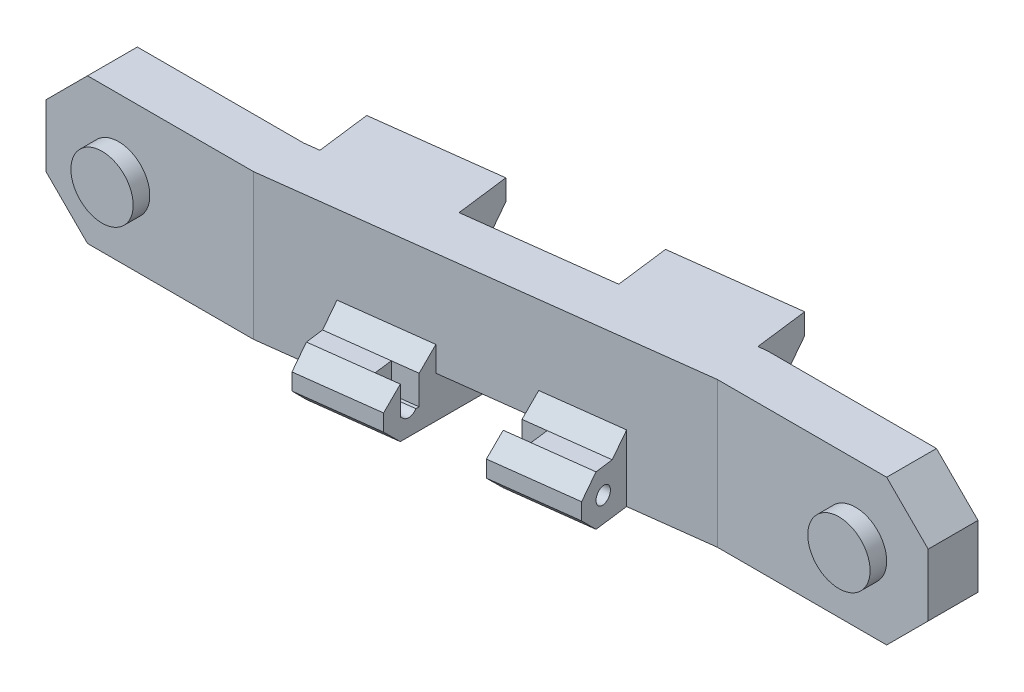
from build123d import *

# Parameters (mm, degrees)
BOSS_EXTRUDE4_DEPTH      = 2.4
BOSS_EXTRUDE4_2_DEPTH    = 2.4
BOSS_EXTRUDE4_3_DEPTH    = 2.4
BOSS_EXTRUDE4_4_DEPTH    = 2.4
BOSS_EXTRUDE5_DEPTH      = 7
SKETCH2_R                = 1.499999999999997
BOSS_EXTRUDE8_DEPTH      = 0.8
SKETCH3_R                = 1.5000000000000007
BOSS_EXTRUDE9_DEPTH      = 0.8
SKETCH4_R                = 1.6999999999999995
CUT_EXTRUDE3_DEPTH       = 1.2
SKETCH5_R                = 1.6999999999999995
CUT_EXTRUDE4_DEPTH       = 1.2
CHAMFER4_SIZE            = 2
CUT_EXTRUDE7_REACH       = 33.329
SKETCH8_R                = 0.3999999999999905
SKETCH8_R_2              = 0.4000000000000032
CUT_EXTRUDE10_DEPTH      = 2
CHAMFER6_SIZE            = 0.8
CUT_EXTRUDE11_DEPTH      = 10
CUT_EXTRUDE11_DEPTH_BACK = 1.4
BOSS_EXTRUDE10_DEPTH     = 3.6
CHAMFER8_SIZE            = 2.6


with BuildPart() as part:
    # Sketch1 → Boss-Extrude4 (new body)
    with BuildSketch(Plane(origin=(0, 0, 0), x_dir=(1, 0, 0), z_dir=(0, 1, 0))):
        Polygon((-6.430686748297487, -2.000308799271804), (-6.118186748297487, -4.480700653394857), (-2.1999999999999993, -3.9870555235708633), (-2.1999999999999997, -1.4672923701760037), align=None)
    extrude(amount=BOSS_EXTRUDE4_DEPTH)



with BuildPart() as body_2:
    # Sketch1 → Boss-Extrude4 2 (new body)
    with BuildSketch(Plane(origin=(0, 0, 0), x_dir=(1, 0, 0), z_dir=(0, 1, 0))):
        Polygon((-10.000000000000064, 2.4499999999999993), (-9.689951018234682, -0.01093750000000027), (-6.316618096627332, 0.41406249999999967), (-6.626667078392713, 2.8750000000000004), align=None)
    extrude(amount=BOSS_EXTRUDE4_2_DEPTH)


with BuildPart() as body_3:
    # Sketch1 → Boss-Extrude4 3 (new body)
    with BuildSketch(Plane(origin=(0, 0, 0), x_dir=(1, 0, 0), z_dir=(0, 1, 0))):
        Polygon((5.961321581281771, -0.4390625000000079), (2.200000000000001, -0.9129444764291388), (2.200000000000001, -3.432707629823996), (6.273821581281774, -2.919454354123064), align=None)
    extrude(amount=BOSS_EXTRUDE4_3_DEPTH)


with BuildPart() as body_4:
    # Sketch1 → Boss-Extrude4 4 (new body)
    with BuildSketch(Plane(origin=(0, 0, 0), x_dir=(1, 0, 0), z_dir=(0, 1, 0))):
        Polygon((6.159752929611616, 4.485937500000006), (6.469801911377001, 2.025000000000001), (9.843134832984354, 2.4499999999999993), (9.533085851218969, 4.910937500000012), align=None)
    extrude(amount=BOSS_EXTRUDE4_4_DEPTH)


with BuildPart() as part_1:
    add(part.part)

    add(body_2.part)  # Boss-Extrude5 merges body 2

    add(body_3.part)  # Boss-Extrude5 merges body 3

    add(body_4.part)  # Boss-Extrude5 merges body 4
    # Sketch1<8> → Boss-Extrude5 (add)
    with BuildSketch(Plane(origin=(0, 0, 0), x_dir=(1, 0, 0), z_dir=(0, 1, 0))):
        Polygon((-20, -0.05000000000000027), (-20, -2.45), (-12, -2.4499999999999997), (-10.000000000000064, -2.4499999999999997), (-6.430686748297488, -2.000308799271796), (-2.5125, -1.5066636694477982), (-2.1999999999999993, -1.467292370176004), (-2.1999999999999997, 0.9327076298239989), (-6.316618096627332, 0.41406249999999967), (-9.689951018234682, -0.01093750000000025), (-10.000000000000064, -0.05000000000000029), (-12, -0.05000000000000027), align=None)
        Polygon((2.2000000000000006, 1.487055523570866), (2.2000000000000006, -0.9129444764291423), (5.961321581281771, -0.4390625000000079), (9.687500000000064, 0.03039185412306233), (9.843134832984425, 0.05000000000000027), (12, 0.05000000000000013), (20, 0.05000000000000013), (20, 2.4499999999999997), (12, 2.4499999999999993), (9.843134832984353, 2.4499999999999993), (6.469801911376997, 2.024999999999999), (2.510048981765383, 1.526118023570866), align=None)
        Polygon((-2.1999999999999997, 0.9327076298239989), (-2.1999999999999997, -1.4672923701760037), (2.200000000000001, -0.9129444764291388), (2.2000000000000006, 1.487055523570866), align=None)
    extrude(amount=BOSS_EXTRUDE5_DEPTH)

    # Sketch2 → Boss-Extrude8 (add)
    with BuildSketch(Plane.XY.offset(2.4499999999999993)):
        with Locations(Location((-16.5, 3.4999999999999996, 0), (0, 0, 180))):
            Circle(SKETCH2_R)
    extrude(amount=BOSS_EXTRUDE8_DEPTH)

    # Sketch3 → Boss-Extrude9 (add)
    with BuildSketch(Plane.XY.offset(-0.05000000000000013)):
        with Locations(Location((16.5, 3.4999999999999996, 0), (0, 0, 180))):
            Circle(SKETCH3_R)
    extrude(amount=BOSS_EXTRUDE9_DEPTH)

    # Sketch4 → Cut-Extrude3 (cut)
    with BuildSketch(Plane(origin=(0, 0, 0.05000000000000041), x_dir=(-1, 0, -5e-17), z_dir=(5e-17, 0, -1))):
        with Locations((16.5, 3.4999999999999996)):
            Circle(SKETCH4_R)
    extrude(amount=-CUT_EXTRUDE3_DEPTH, mode=Mode.SUBTRACT)

    # Sketch5 → Cut-Extrude4 (cut)
    with BuildSketch(Plane(origin=(-1e-16, 0, -2.449999999999999), x_dir=(-1, 0, 5e-17), z_dir=(-5e-17, 0, -1))):
        with Locations((-16.5, 3.4999999999999996)):
            Circle(SKETCH5_R)
    extrude(amount=-CUT_EXTRUDE4_DEPTH, mode=Mode.SUBTRACT)

    # Chamfer4
    chamfer4_edges = [part_1.edges().sort_by_distance(p)[0] for p in [
        (20, 7, -1.25),
        (-20, 7, 1.2500000000000002),
        (-20, 0, 1.2500000000000002),
        (20, 0, -1.25),
    ]]
    chamfer(chamfer4_edges, length=CHAMFER4_SIZE)

    # Cut-Extrude7: up to this face of the body (flat: up to its plane)
    cut_extrude7_end = Plane(part_1.part.faces().sort_by_distance((-9.844975509, 1.2, -1.21953125))[0])
    # Sketch8 → Cut-Extrude7 (cut, up to the picked face)
    with BuildSketch(Plane(origin=(9.99318385334905, 0, -1.2590228229384695), x_dir=(-0.12500000000000053, 0, -0.9921567416492215), z_dir=(0.9921567416492215, 0, -0.12500000000000053)), mode=Mode.PRIVATE) as cut_extrude7_sk1:
        with Locations((2.4807840170405906, 1.2000000000000017)):
            Circle(SKETCH8_R)
    cut_extrude7_tool1 = split(extrude(cut_extrude7_sk1.sketch, amount=-CUT_EXTRUDE7_REACH, mode=Mode.PRIVATE), bisect_by=cut_extrude7_end, keep=Keep.BOTH, mode=Mode.PRIVATE)
    # Sketch8 → Cut-Extrude7 (cut, up to the picked face)
    with BuildSketch(Plane(origin=(9.99318385334905, 0, -1.2590228229384695), x_dir=(-0.12500000000000053, 0, -0.9921567416492215), z_dir=(0.9921567416492215, 0, -0.12500000000000053)), mode=Mode.PRIVATE) as cut_extrude7_sk2:
        with Locations((-2.4807840170405973, 1.200000000000001)):
            Circle(SKETCH8_R_2)
    cut_extrude7_tool2 = split(extrude(cut_extrude7_sk2.sketch, amount=-CUT_EXTRUDE7_REACH, mode=Mode.PRIVATE), bisect_by=cut_extrude7_end, keep=Keep.BOTH, mode=Mode.PRIVATE)
    add(cut_extrude7_tool1.solids().sort_by(Axis((9.683086, 1.2, -3.720349), (-0.9921567416492215, 0, 0.12500000000000053)))[0], mode=Mode.SUBTRACT)
    add(cut_extrude7_tool2.solids().sort_by(Axis((10.303282, 1.2, 1.202304), (-0.9921567416492215, 0, 0.12500000000000053)))[0], mode=Mode.SUBTRACT)

    # Sketch1<10> → Cut-Extrude10 (cut)
    with BuildSketch(Plane(origin=(0, 0, 0), x_dir=(1, 0, 0), z_dir=(0, 1, 0))):
        Polygon((-2.1999999999999997, 0.9327076298239989), (-2.1999999999999997, -1.4672923701760037), (2.200000000000001, -0.9129444764291388), (2.2000000000000006, 1.487055523570866), align=None)
        Polygon((-2.2, 3.432707629823986), (-2.1999999999999997, 0.9327076298239989), (2.200000000000001, 1.487055523570866), (2.2, 3.987055523570867), align=None)
        Polygon((2.200000000000001, -0.9129444764291388), (-2.1999999999999993, -1.467292370176004), (-2.1999999999999993, -3.9870555235708607), (2.200000000000003, -3.432707629823997), align=None)
    extrude(amount=CUT_EXTRUDE10_DEPTH, mode=Mode.SUBTRACT)

    # Chamfer6
    chamfer6_edges = [part_1.edges().sort_by_distance(p)[0] for p in [
        (4.080660790640886, 2.4, 0.6760034882145733),
        (-4.315343374148743, 2.4, 1.7338005847239037),
        (-4.159093374148743, 0, 4.233878088482863),
        (-4.159093374148743, 2.4, 4.233878088482863),
        (7.846419390415299, 2.4, -4.698437499999993),
        (8.156468372180676, 2.4, -2.237499999999999),
        (7.846419390415299, 0, -4.698437499999993),
        (4.236910790640888, 2.4, 3.1760809919735298),
        (-8.313333539196389, 2.4, -2.6624999999999988),
        (-8.003284557431007, 2.4, -0.20156249999999976),
        (-8.313333539196389, 0, -2.6624999999999988),
        (4.236910790640888, 0, 3.1760809919735298),
    ]]
    chamfer(chamfer6_edges, length=CHAMFER6_SIZE)

    # Sketch9 → Cut-Extrude11 (cut, two sides: drawn at the far end of the back side and taken through both)
    with BuildSketch(Plane(origin=(0, 2.4, 0), x_dir=(1, 0, 0), z_dir=(0, 1, 0)).offset(-CUT_EXTRUDE11_DEPTH_BACK)):
        Polygon((-9.900000000000063, 1.6562746066806198), (-9.789951018234682, 0.7827878933193786), (-8.599362928255616, 0.9327878933193787), (-8.709411910020998, 1.8062746066806201), align=None)
        Polygon((-2.1999999999999993, -2.2736165792623466), (-3.390588089979065, -2.423616579262345), (-3.2780880899790614, -3.3165576467466713), (-2.087499999999996, -3.1665576467466714), align=None)
        Polygon((2.200000000000001, -2.626383420737649), (2.087499999999998, -1.733442353253328), (3.278088089979064, -1.5834423532533284), (3.3905880899790666, -2.47638342073765), align=None)
        Polygon((9.633085851218974, 4.117212106680604), (8.442497761239908, 3.967212106680604), (8.552546743005287, 3.0937253933193816), (9.743134832984353, 3.2437253933193815), align=None)
    extrude(amount=CUT_EXTRUDE11_DEPTH + CUT_EXTRUDE11_DEPTH_BACK, mode=Mode.SUBTRACT)

    # Sketch10 → Boss-Extrude10 (add)
    with BuildSketch(Plane(origin=(0, 6.999999999999999, 0), x_dir=(1, 0, 0), z_dir=(0, 1, 0))):
        Polygon((9.121272136324666, 4.979607528287985), (3.168331686429335, 4.22960752828798), (3.493331686429336, 1.6499999999999986), (9.446272136324666, 2.4000000000000035), align=None)
        Polygon((-9.618088321575, 2.6186700282879727), (-9.293088321574997, 0.03906249999999938), (-3.3401478716796675, 0.7890624999999998), (-3.665147871679668, 3.3686700282879767), align=None)
    extrude(amount=-BOSS_EXTRUDE10_DEPTH)

    # Chamfer8
    chamfer8_edges = [part_1.edges().sort_by_distance(p)[0] for p in [
        (-6.641618096627334, 3.399999999999999, -2.9936700282879745),
        (6.144801911377001, 3.399999999999999, -4.604607528287982),
    ]]
    chamfer(chamfer8_edges, length=CHAMFER8_SIZE - 0.0001)  # a hair under: the kernel refuses the full size


solid = part_1.part
